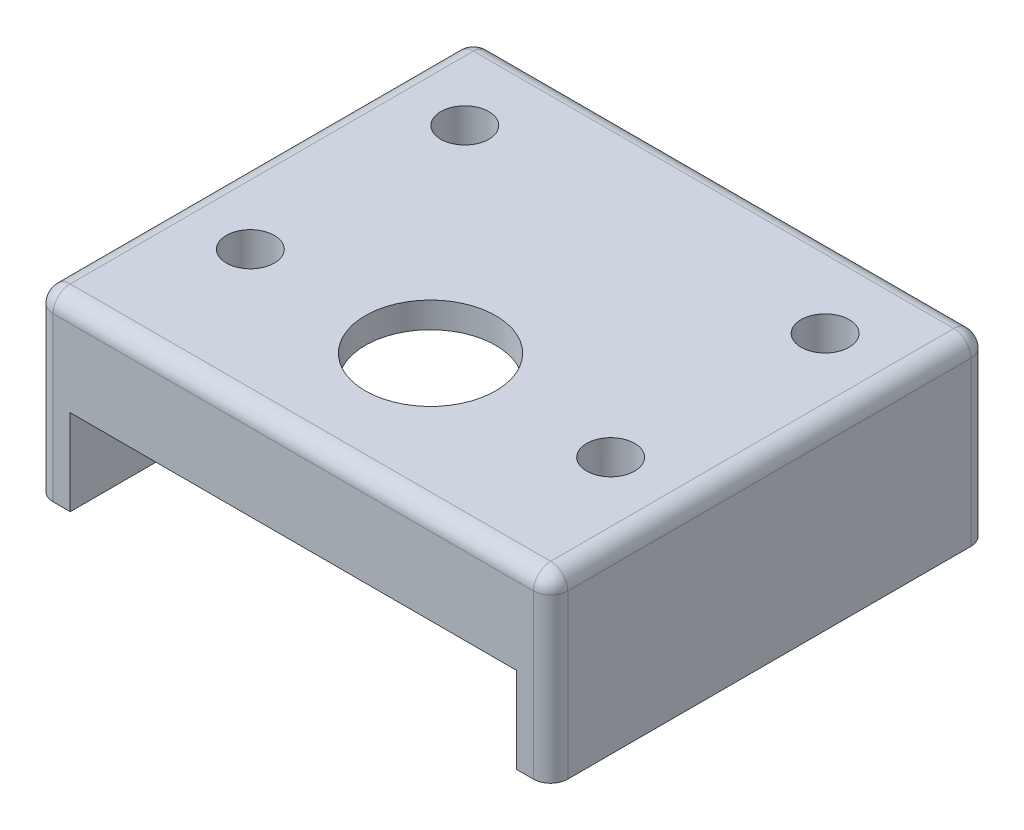
from build123d import *

# Parameters (mm, degrees)
BOSS_EXTRUDE1_DEPTH = 10.5
SKETCH3_R           = 1.4
SKETCH3_R_2         = 3.8
BOSS_EXTRUDE2_DEPTH = 1.5
SKETCH4_W           = 26
SKETCH4_H           = 2
SKETCH4_R           = 1.4
BOSS_EXTRUDE3_DEPTH = 4
FILLET1_R           = 1


with BuildPart() as part:
    # Sketch1 → Boss-Extrude1 (new body)
    with BuildSketch(Plane(origin=(0, 0, 0), x_dir=(1, 0, 0), z_dir=(0, 1, 0))):
        Polygon((26, 0), (28, 0), (28, 25.5), (-2, 25.5), (-2, 0), (0, 0), (0, 23.5), (26, 23.5), align=None)
    extrude(amount=BOSS_EXTRUDE1_DEPTH)

    # Sketch3 → Boss-Extrude2 (add)
    with BuildSketch(Plane(origin=(0, 10.5, 0), x_dir=(1, 0, 0), z_dir=(0, 1, 0))):
        Polygon((0, 0), (26, 0), (28, 0), (28, 25.5), (-2, 25.5), (-2, 0), align=None)
        with Locations(Location((2.5, 20.5, 0), (0, 0, 270))):
            Circle(SKETCH3_R, mode=Mode.SUBTRACT)
        with Locations(Location((2.5, 8, 0), (0, 0, 270))):
            Circle(SKETCH3_R, mode=Mode.SUBTRACT)
        with Locations(Location((23.5, 8, 0), (0, 0, 270))):
            Circle(SKETCH3_R, mode=Mode.SUBTRACT)
        with Locations(Location((23.5, 20.5, 0), (0, 0, 270))):
            Circle(SKETCH3_R, mode=Mode.SUBTRACT)
        with Locations(Location((13, 8, 0), (0, 0, 270))):
            Circle(SKETCH3_R_2, mode=Mode.SUBTRACT)
    extrude(amount=-BOSS_EXTRUDE2_DEPTH)

    # Sketch4 → Boss-Extrude3 (add)
    # profile 1 of 5: a face of its own
    with BuildSketch(Plane.XZ.offset(-9)):
        with Locations((13, -1)):
            Rectangle(SKETCH4_W, SKETCH4_H)
    # profile 2 of 5: a face of its own
    with BuildSketch(Plane.XZ.offset(-9)):
        with BuildLine():
            Line((2.5, -5.5), (0, -5.5))
            Line((0, -5.5), (0, -10.5))
            Line((0, -10.5), (2.5, -10.5))
            ThreePointArc((2.5, -10.5), (5, -8), (2.5, -5.5))
        make_face()
        with Locations(Location((2.5, -8, 0), (0, 0, 90))):
            Circle(SKETCH4_R, mode=Mode.SUBTRACT)
    # profile 3 of 5: a face of its own
    with BuildSketch(Plane.XZ.offset(-9)):
        with BuildLine():
            Line((2.5, -23), (0, -23))
            Line((0, -23), (0, -18))
            Line((0, -18), (2.5, -18))
            ThreePointArc((2.5, -18), (5, -20.5), (2.5, -23))
        make_face()
        with Locations(Location((2.5, -20.5, 0), (0, 0, 90))):
            Circle(SKETCH4_R, mode=Mode.SUBTRACT)
    # profile 4 of 5: a face of its own
    with BuildSketch(Plane.XZ.offset(-9)):
        with BuildLine():
            Line((26, -23), (26, -18))
            Line((26, -18), (23.5, -18))
            ThreePointArc((23.5, -18), (21, -20.5), (23.5, -23))
            Line((23.5, -23), (26, -23))
        make_face()
        with Locations(Location((23.5, -20.5, 0), (0, 0, 90))):
            Circle(SKETCH4_R, mode=Mode.SUBTRACT)
    # profile 5 of 5: a face of its own
    with BuildSketch(Plane.XZ.offset(-9)):
        with BuildLine():
            Line((23.5, -5.5), (26, -5.5))
            Line((26, -5.5), (26, -10.5))
            Line((26, -10.5), (23.5, -10.5))
            ThreePointArc((23.5, -10.5), (21, -8), (23.5, -5.5))
        make_face()
        with Locations(Location((23.5, -8, 0), (0, 0, 90))):
            Circle(SKETCH4_R, mode=Mode.SUBTRACT)
    extrude(amount=BOSS_EXTRUDE3_DEPTH)

    # Fillet1
    # the kernel refuses this fillet: 1 mm, written as the material it adds along each edge
    with BuildSketch(Plane(origin=(0, 9, -23.5), x_dir=(0, -1, 0), z_dir=(1, 0, 0)), Plane(origin=(26, 9, -2), x_dir=(0, -1, 0), z_dir=(-1, 0, 0))) as fillet1_piece_1:
        with BuildLine():
            CenterArc((FILLET1_R, -FILLET1_R), FILLET1_R, 90, 90)
            Line((0, -FILLET1_R), (-FILLET1_R * 0.02, -FILLET1_R))
            Line((-FILLET1_R * 0.02, -FILLET1_R), (-FILLET1_R * 0.02, FILLET1_R * 0.02))
            Line((-FILLET1_R * 0.02, FILLET1_R * 0.02), (FILLET1_R, FILLET1_R * 0.02))
            Line((FILLET1_R, FILLET1_R * 0.02), (FILLET1_R, 0))
        make_face()
    extrude(amount=26)
    with BuildSketch(Plane(origin=(26, 9, -5.5), x_dir=(0, -1, 0), z_dir=(0, 0, 1)), Plane(origin=(0, 9, -2), x_dir=(0, -1, 0), z_dir=(0, 0, -1))) as fillet1_piece_2:
        with BuildLine():
            CenterArc((FILLET1_R, -FILLET1_R), FILLET1_R, 90, 90)
            Line((0, -FILLET1_R), (-FILLET1_R * 0.02, -FILLET1_R))
            Line((-FILLET1_R * 0.02, -FILLET1_R), (-FILLET1_R * 0.02, FILLET1_R * 0.02))
            Line((-FILLET1_R * 0.02, FILLET1_R * 0.02), (FILLET1_R, FILLET1_R * 0.02))
            Line((FILLET1_R, FILLET1_R * 0.02), (FILLET1_R, 0))
        make_face()
    extrude(amount=3.5)
    with BuildSketch(Plane(origin=(26, 9, -18), x_dir=(0, -1, 0), z_dir=(0, 0, 1)), Plane(origin=(0, 9, -10.5), x_dir=(0, -1, 0), z_dir=(0, 0, -1))) as fillet1_piece_3:
        with BuildLine():
            CenterArc((FILLET1_R, -FILLET1_R), FILLET1_R, 90, 90)
            Line((0, -FILLET1_R), (-FILLET1_R * 0.02, -FILLET1_R))
            Line((-FILLET1_R * 0.02, -FILLET1_R), (-FILLET1_R * 0.02, FILLET1_R * 0.02))
            Line((-FILLET1_R * 0.02, FILLET1_R * 0.02), (FILLET1_R, FILLET1_R * 0.02))
            Line((FILLET1_R, FILLET1_R * 0.02), (FILLET1_R, 0))
        make_face()
    extrude(amount=7.5)
    with BuildSketch(Plane(origin=(0, 0, -23.5), x_dir=(0, 0, 1), z_dir=(0, 1, 0))) as fillet1_piece_4:
        with BuildLine():
            CenterArc((FILLET1_R, FILLET1_R), FILLET1_R, 180, 90)
            Line((0, FILLET1_R), (-FILLET1_R * 0.02, FILLET1_R))
            Line((-FILLET1_R * 0.02, FILLET1_R), (-FILLET1_R * 0.02, -FILLET1_R * 0.02))
            Line((-FILLET1_R * 0.02, -FILLET1_R * 0.02), (FILLET1_R, -FILLET1_R * 0.02))
            Line((FILLET1_R, -FILLET1_R * 0.02), (FILLET1_R, 0))
        make_face()
    extrude(amount=9)
    with BuildSketch(Plane(origin=(26, 0, -23.5), x_dir=(0, 0, 1), z_dir=(0, 1, 0))) as fillet1_piece_5:
        with BuildLine():
            CenterArc((FILLET1_R, -FILLET1_R), FILLET1_R, 90, 90)
            Line((0, -FILLET1_R), (-FILLET1_R * 0.02, -FILLET1_R))
            Line((-FILLET1_R * 0.02, -FILLET1_R), (-FILLET1_R * 0.02, FILLET1_R * 0.02))
            Line((-FILLET1_R * 0.02, FILLET1_R * 0.02), (FILLET1_R, FILLET1_R * 0.02))
            Line((FILLET1_R, FILLET1_R * 0.02), (FILLET1_R, 0))
        make_face()
    extrude(amount=9)
    with BuildSketch(Plane(origin=(0, 0, -23.5), x_dir=(0, 0, 1), z_dir=(0, 1, 0))) as fillet1_piece_6a_section:
        with BuildLine():
            CenterArc((FILLET1_R, FILLET1_R), FILLET1_R, 180, 90)
            Line((0, FILLET1_R), (-FILLET1_R * 0.02, FILLET1_R))
            Line((-FILLET1_R * 0.02, FILLET1_R), (-FILLET1_R * 0.02, -FILLET1_R * 0.02))
            Line((-FILLET1_R * 0.02, -FILLET1_R * 0.02), (FILLET1_R, -FILLET1_R * 0.02))
            Line((FILLET1_R, -FILLET1_R * 0.02), (FILLET1_R, 0))
        make_face()
    fillet1_piece_6a = extrude(amount=11.5, mode=Mode.PRIVATE)
    fillet1_piece_6a = split(fillet1_piece_6a, bisect_by=Plane(origin=(0.226395114, 9, -23.273604886), z_dir=(0, 1, 0)), keep=Keep.TOP, mode=Mode.PRIVATE)
    with BuildSketch(Plane(origin=(-2.5, 9, -23.5), x_dir=(0, -1, 0), z_dir=(1, 0, 0))) as fillet1_piece_6b_section:
        with BuildLine():
            CenterArc((FILLET1_R, -FILLET1_R), FILLET1_R, 90, 90)
            Line((0, -FILLET1_R), (-FILLET1_R * 0.02, -FILLET1_R))
            Line((-FILLET1_R * 0.02, -FILLET1_R), (-FILLET1_R * 0.02, FILLET1_R * 0.02))
            Line((-FILLET1_R * 0.02, FILLET1_R * 0.02), (FILLET1_R, FILLET1_R * 0.02))
            Line((FILLET1_R, FILLET1_R * 0.02), (FILLET1_R, 0))
        make_face()
    fillet1_piece_6b = extrude(amount=28.5, mode=Mode.PRIVATE)
    fillet1_piece_6b = split(fillet1_piece_6b, bisect_by=Plane(origin=(0, 8.773604886, -23.273604886), z_dir=(-1, 0, 0)), keep=Keep.TOP, mode=Mode.PRIVATE)
    fillet1_piece_6 = fillet1_piece_6a & fillet1_piece_6b
    add(fillet1_piece_6)
    with BuildSketch(Plane(origin=(26, 0, -23.5), x_dir=(0, 0, 1), z_dir=(0, 1, 0))) as fillet1_piece_7a_section:
        with BuildLine():
            CenterArc((FILLET1_R, -FILLET1_R), FILLET1_R, 90, 90)
            Line((0, -FILLET1_R), (-FILLET1_R * 0.02, -FILLET1_R))
            Line((-FILLET1_R * 0.02, -FILLET1_R), (-FILLET1_R * 0.02, FILLET1_R * 0.02))
            Line((-FILLET1_R * 0.02, FILLET1_R * 0.02), (FILLET1_R, FILLET1_R * 0.02))
            Line((FILLET1_R, FILLET1_R * 0.02), (FILLET1_R, 0))
        make_face()
    fillet1_piece_7a = extrude(amount=11.5, mode=Mode.PRIVATE)
    fillet1_piece_7a = split(fillet1_piece_7a, bisect_by=Plane(origin=(25.773604886, 9, -23.273604886), z_dir=(0, 1, 0)), keep=Keep.TOP, mode=Mode.PRIVATE)
    with BuildSketch(Plane(origin=(0, 9, -23.5), x_dir=(0, -1, 0), z_dir=(1, 0, 0))) as fillet1_piece_7b_section:
        with BuildLine():
            CenterArc((FILLET1_R, -FILLET1_R), FILLET1_R, 90, 90)
            Line((0, -FILLET1_R), (-FILLET1_R * 0.02, -FILLET1_R))
            Line((-FILLET1_R * 0.02, -FILLET1_R), (-FILLET1_R * 0.02, FILLET1_R * 0.02))
            Line((-FILLET1_R * 0.02, FILLET1_R * 0.02), (FILLET1_R, FILLET1_R * 0.02))
            Line((FILLET1_R, FILLET1_R * 0.02), (FILLET1_R, 0))
        make_face()
    fillet1_piece_7b = extrude(amount=28.5, mode=Mode.PRIVATE)
    fillet1_piece_7b = split(fillet1_piece_7b, bisect_by=Plane(origin=(26, 8.773604886, -23.273604886), z_dir=(1, 0, 0)), keep=Keep.TOP, mode=Mode.PRIVATE)
    fillet1_piece_7 = fillet1_piece_7a & fillet1_piece_7b
    add(fillet1_piece_7)
    with BuildSketch(Plane(origin=(26, 9, -5.5), x_dir=(0, -1, 0), z_dir=(0, 0, 1))) as fillet1_piece_8a_section:
        with BuildLine():
            CenterArc((FILLET1_R, -FILLET1_R), FILLET1_R, 90, 90)
            Line((0, -FILLET1_R), (-FILLET1_R * 0.02, -FILLET1_R))
            Line((-FILLET1_R * 0.02, -FILLET1_R), (-FILLET1_R * 0.02, FILLET1_R * 0.02))
            Line((-FILLET1_R * 0.02, FILLET1_R * 0.02), (FILLET1_R, FILLET1_R * 0.02))
            Line((FILLET1_R, FILLET1_R * 0.02), (FILLET1_R, 0))
        make_face()
    fillet1_piece_8a = extrude(amount=6, mode=Mode.PRIVATE)
    fillet1_piece_8a = split(fillet1_piece_8a, bisect_by=Plane(origin=(25.773604886, 8.773604886, -2), z_dir=(0, 0, 1)), keep=Keep.TOP, mode=Mode.PRIVATE)
    with BuildSketch(Plane(origin=(28.5, 9, -2), x_dir=(0, -1, 0), z_dir=(-1, 0, 0))) as fillet1_piece_8b_section:
        with BuildLine():
            CenterArc((FILLET1_R, -FILLET1_R), FILLET1_R, 90, 90)
            Line((0, -FILLET1_R), (-FILLET1_R * 0.02, -FILLET1_R))
            Line((-FILLET1_R * 0.02, -FILLET1_R), (-FILLET1_R * 0.02, FILLET1_R * 0.02))
            Line((-FILLET1_R * 0.02, FILLET1_R * 0.02), (FILLET1_R, FILLET1_R * 0.02))
            Line((FILLET1_R, FILLET1_R * 0.02), (FILLET1_R, 0))
        make_face()
    fillet1_piece_8b = extrude(amount=28.5, mode=Mode.PRIVATE)
    fillet1_piece_8b = split(fillet1_piece_8b, bisect_by=Plane(origin=(26, 8.773604886, -2.226395114), z_dir=(1, 0, 0)), keep=Keep.TOP, mode=Mode.PRIVATE)
    fillet1_piece_8 = fillet1_piece_8a & fillet1_piece_8b
    add(fillet1_piece_8)
    with BuildSketch(Plane(origin=(0, 9, 0.5), x_dir=(0, -1, 0), z_dir=(0, 0, -1))) as fillet1_piece_9a_section:
        with BuildLine():
            CenterArc((FILLET1_R, -FILLET1_R), FILLET1_R, 90, 90)
            Line((0, -FILLET1_R), (-FILLET1_R * 0.02, -FILLET1_R))
            Line((-FILLET1_R * 0.02, -FILLET1_R), (-FILLET1_R * 0.02, FILLET1_R * 0.02))
            Line((-FILLET1_R * 0.02, FILLET1_R * 0.02), (FILLET1_R, FILLET1_R * 0.02))
            Line((FILLET1_R, FILLET1_R * 0.02), (FILLET1_R, 0))
        make_face()
    fillet1_piece_9a = extrude(amount=6, mode=Mode.PRIVATE)
    fillet1_piece_9a = split(fillet1_piece_9a, bisect_by=Plane(origin=(0.226395114, 8.773604886, -2), z_dir=(0, 0, 1)), keep=Keep.TOP, mode=Mode.PRIVATE)
    with BuildSketch(Plane(origin=(26, 9, -2), x_dir=(0, -1, 0), z_dir=(-1, 0, 0))) as fillet1_piece_9b_section:
        with BuildLine():
            CenterArc((FILLET1_R, -FILLET1_R), FILLET1_R, 90, 90)
            Line((0, -FILLET1_R), (-FILLET1_R * 0.02, -FILLET1_R))
            Line((-FILLET1_R * 0.02, -FILLET1_R), (-FILLET1_R * 0.02, FILLET1_R * 0.02))
            Line((-FILLET1_R * 0.02, FILLET1_R * 0.02), (FILLET1_R, FILLET1_R * 0.02))
            Line((FILLET1_R, FILLET1_R * 0.02), (FILLET1_R, 0))
        make_face()
    fillet1_piece_9b = extrude(amount=28.5, mode=Mode.PRIVATE)
    fillet1_piece_9b = split(fillet1_piece_9b, bisect_by=Plane(origin=(0, 8.773604886, -2.226395114), z_dir=(-1, 0, 0)), keep=Keep.TOP, mode=Mode.PRIVATE)
    fillet1_piece_9 = fillet1_piece_9a & fillet1_piece_9b
    add(fillet1_piece_9)
    # the kernel refuses this fillet: 1 mm, written as the material it takes off along each edge
    with BuildSketch(Plane(origin=(27, 9.5, -1), x_dir=(0, 1, 0), z_dir=(0, 0, 1))) as fillet1_2_piece_1_section:
        Polygon((0, 0), (FILLET1_R * 1.02, 0), (FILLET1_R * 1.02, -FILLET1_R * 1.02), (0, -FILLET1_R * 1.02), align=None)
    fillet1_2_piece_1 = extrude(amount=FILLET1_R * 1.02, mode=Mode.PRIVATE)
    fillet1_2_piece_1 = fillet1_2_piece_1 - Plane(origin=(27, 9.5, -1), x_dir=(-0.7071067811865475, -0.7071067811865475, 0), z_dir=(0, 0, 1)) * Sphere(FILLET1_R, mode=Mode.PRIVATE)
    add(fillet1_2_piece_1, mode=Mode.SUBTRACT)
    with BuildSketch(Plane(origin=(-1, 9.5, -1), x_dir=(-1, 0, 0), z_dir=(0, 0, 1))) as fillet1_2_piece_2_section:
        Polygon((0, 0), (FILLET1_R * 1.02, 0), (FILLET1_R * 1.02, -FILLET1_R * 1.02), (0, -FILLET1_R * 1.02), align=None)
    fillet1_2_piece_2 = extrude(amount=FILLET1_R * 1.02, mode=Mode.PRIVATE)
    fillet1_2_piece_2 = fillet1_2_piece_2 - Plane(origin=(-1, 9.5, -1), x_dir=(0.7071067811865475, -0.7071067811865475, 0), z_dir=(0, 0, 1)) * Sphere(FILLET1_R, mode=Mode.PRIVATE)
    add(fillet1_2_piece_2, mode=Mode.SUBTRACT)
    with BuildSketch(Plane(origin=(27, 9.5, -24.5), x_dir=(0, 1, 0), z_dir=(0, 0, -1))) as fillet1_2_piece_3_section:
        Polygon((0, 0), (FILLET1_R * 1.02, 0), (FILLET1_R * 1.02, FILLET1_R * 1.02), (0, FILLET1_R * 1.02), align=None)
    fillet1_2_piece_3 = extrude(amount=FILLET1_R * 1.02, mode=Mode.PRIVATE)
    fillet1_2_piece_3 = fillet1_2_piece_3 - Plane(origin=(27, 9.5, -24.5), x_dir=(-0.7071067811865475, -0.7071067811865475, 0), z_dir=(0, 0, -1)) * Sphere(FILLET1_R, mode=Mode.PRIVATE)
    add(fillet1_2_piece_3, mode=Mode.SUBTRACT)
    with BuildSketch(Plane(origin=(-1, 9.5, -24.5), x_dir=(-1, 0, 0), z_dir=(0, 0, -1))) as fillet1_2_piece_4_section:
        Polygon((0, 0), (FILLET1_R * 1.02, 0), (FILLET1_R * 1.02, FILLET1_R * 1.02), (0, FILLET1_R * 1.02), align=None)
    fillet1_2_piece_4 = extrude(amount=FILLET1_R * 1.02, mode=Mode.PRIVATE)
    fillet1_2_piece_4 = fillet1_2_piece_4 - Plane(origin=(-1, 9.5, -24.5), x_dir=(0.7071067811865475, -0.7071067811865475, 0), z_dir=(0, 0, -1)) * Sphere(FILLET1_R, mode=Mode.PRIVATE)
    add(fillet1_2_piece_4, mode=Mode.SUBTRACT)
    with BuildSketch(Plane(origin=(28, 0, 0), x_dir=(-1, 0, 0), z_dir=(0, 1, 0)), Plane(origin=(-2, 9.5, 0), x_dir=(1, 0, 0), z_dir=(0, -1, 0)), Plane(origin=(28, 0, -25.5), x_dir=(0, 0, 1), z_dir=(0, 1, 0))) as fillet1_2_piece_5:
        with BuildLine():
            CenterArc((FILLET1_R, -FILLET1_R), FILLET1_R, 90, 90)
            Line((0, -FILLET1_R), (-FILLET1_R * 0.02, -FILLET1_R))
            Line((-FILLET1_R * 0.02, -FILLET1_R), (-FILLET1_R * 0.02, FILLET1_R * 0.02))
            Line((-FILLET1_R * 0.02, FILLET1_R * 0.02), (FILLET1_R, FILLET1_R * 0.02))
            Line((FILLET1_R, FILLET1_R * 0.02), (FILLET1_R, 0))
        make_face()
    extrude(amount=9.5, mode=Mode.SUBTRACT)
    with BuildSketch(Plane(origin=(27, 10.5, -25.5), x_dir=(0, 0, 1), z_dir=(-1, 0, 0)), Plane(origin=(27, 10.5, 0), x_dir=(0, -1, 0), z_dir=(-1, 0, 0))) as fillet1_2_piece_6:
        with BuildLine():
            CenterArc((FILLET1_R, -FILLET1_R), FILLET1_R, 90, 90)
            Line((0, -FILLET1_R), (-FILLET1_R * 0.02, -FILLET1_R))
            Line((-FILLET1_R * 0.02, -FILLET1_R), (-FILLET1_R * 0.02, FILLET1_R * 0.02))
            Line((-FILLET1_R * 0.02, FILLET1_R * 0.02), (FILLET1_R, FILLET1_R * 0.02))
            Line((FILLET1_R, FILLET1_R * 0.02), (FILLET1_R, 0))
        make_face()
    extrude(amount=28, mode=Mode.SUBTRACT)
    with BuildSketch(Plane(origin=(-2, 0, -25.5), x_dir=(0, 0, 1), z_dir=(0, 1, 0))) as fillet1_2_piece_7:
        with BuildLine():
            CenterArc((FILLET1_R, FILLET1_R), FILLET1_R, 180, 90)
            Line((0, FILLET1_R), (-FILLET1_R * 0.02, FILLET1_R))
            Line((-FILLET1_R * 0.02, FILLET1_R), (-FILLET1_R * 0.02, -FILLET1_R * 0.02))
            Line((-FILLET1_R * 0.02, -FILLET1_R * 0.02), (FILLET1_R, -FILLET1_R * 0.02))
            Line((FILLET1_R, -FILLET1_R * 0.02), (FILLET1_R, 0))
        make_face()
    extrude(amount=9.5, mode=Mode.SUBTRACT)
    with BuildSketch(Plane(origin=(-2, 10.5, -24.5), x_dir=(0, -1, 0), z_dir=(0, 0, 1))) as fillet1_2_piece_8:
        with BuildLine():
            CenterArc((FILLET1_R, FILLET1_R), FILLET1_R, 180, 90)
            Line((0, FILLET1_R), (-FILLET1_R * 0.02, FILLET1_R))
            Line((-FILLET1_R * 0.02, FILLET1_R), (-FILLET1_R * 0.02, -FILLET1_R * 0.02))
            Line((-FILLET1_R * 0.02, -FILLET1_R * 0.02), (FILLET1_R, -FILLET1_R * 0.02))
            Line((FILLET1_R, -FILLET1_R * 0.02), (FILLET1_R, 0))
        make_face()
    extrude(amount=23.5, mode=Mode.SUBTRACT)
    with BuildSketch(Plane(origin=(28, 10.5, -1), x_dir=(-1, 0, 0), z_dir=(0, 0, -1))) as fillet1_2_piece_9:
        with BuildLine():
            CenterArc((FILLET1_R, -FILLET1_R), FILLET1_R, 90, 90)
            Line((0, -FILLET1_R), (-FILLET1_R * 0.02, -FILLET1_R))
            Line((-FILLET1_R * 0.02, -FILLET1_R), (-FILLET1_R * 0.02, FILLET1_R * 0.02))
            Line((-FILLET1_R * 0.02, FILLET1_R * 0.02), (FILLET1_R, FILLET1_R * 0.02))
            Line((FILLET1_R, FILLET1_R * 0.02), (FILLET1_R, 0))
        make_face()
    extrude(amount=23.5, mode=Mode.SUBTRACT)


solid = part.part
